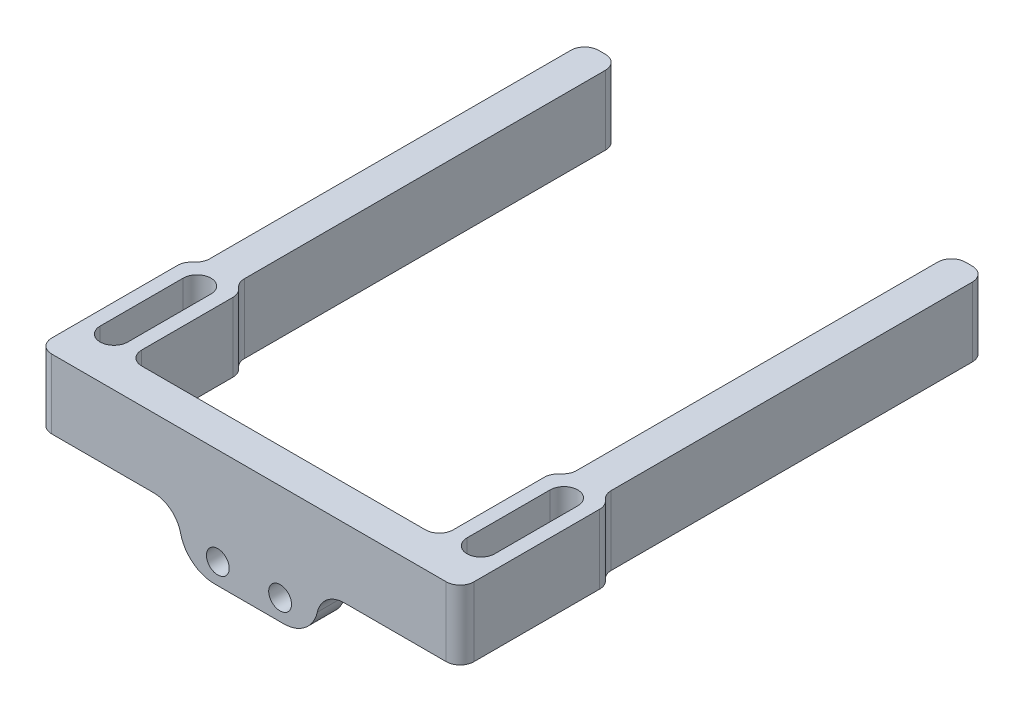
from build123d import *

# Parameters (mm, degrees)
BOSS_EXTRUDE1_DEPTH = 10
FILLET1_R           = 2
FILLET2_R           = 2
BLOCK_START         = 73.5
BLOCK_OUTLINE_R     = 1.65
BLOCK_DEPTH         = 4
BLOCK_START_2       = 77.5
BLOCK_2_DEPTH       = 0.2
CUT_EXTRUDE1_START  = -0.2
CUT_EXTRUDE1_DEPTH  = 0.2
FILLET4_R           = 4


# Read off the part's stored shape, not the designer's step: block
with BuildPart() as part:
    # Sketch1 → Boss-Extrude1 (new body)
    with BuildSketch(Plane(origin=(0, 0, 0), x_dir=(1, 0, 0), z_dir=(0, 1, 0))):
        with BuildLine():
            Line((24, -55), (24, 0))
            Line((24, 0), (29, 0))
            Line((29, 0), (29, -55))
            Line((29, -55), (30.5, -56.5))
            Line((30.5, -56.5), (30.5, -70.5))
            Line((30.5, -70.5), (30.5, -77.5))
            Line((30.5, -77.5), (-30.5, -77.5))
            Line((-30.5, -77.5), (-30.5, -70.5))
            Line((-30.5, -70.5), (-30.5, -56.5))
            Line((-30.5, -56.5), (-29, -55))
            Line((-29, -55), (-29, 0))
            Line((-29, 0), (-24, 0))
            Line((-24, 0), (-24, -55))
            Line((-24, -55), (-22.5, -56.5))
            Line((-22.5, -56.5), (-22.5, -70.5))
            ThreePointArc((-22.5, -70.5), (-21.914213562, -71.914213562), (-20.5, -72.5))
            Line((-20.5, -72.5), (20.5, -72.5))
            ThreePointArc((20.5, -72.5), (21.914213562, -71.914213562), (22.5, -70.5))
            Line((22.5, -70.5), (22.5, -56.5))
            Line((22.5, -56.5), (24, -55))
        make_face()
        with BuildLine():
            Line((24.5, -58.5), (24.5, -70.5))
            ThreePointArc((24.5, -70.5), (26.5, -72.5), (28.5, -70.5))
            Line((28.5, -70.5), (28.5, -58.5))
            ThreePointArc((28.5, -58.5), (26.5, -56.5), (24.5, -58.5))
        make_face(mode=Mode.SUBTRACT)
        with BuildLine():
            Line((-28.5, -70.5), (-28.5, -58.5))
            ThreePointArc((-28.5, -58.5), (-26.5, -56.5), (-24.5, -58.5))
            Line((-24.5, -58.5), (-24.5, -70.5))
            ThreePointArc((-24.5, -70.5), (-26.5, -72.5), (-28.5, -70.5))
        make_face(mode=Mode.SUBTRACT)
    extrude(amount=BOSS_EXTRUDE1_DEPTH)

    # Fillet1
    fillet1_edges = [part.edges().sort_by_distance(p)[0] for p in [
        (30.5, 5, 77.5),
        (-30.5, 5, 77.5),
        (-30.5, 5, 56.5),
        (-29, 5, 55),
        (-24, 5, 55),
        (-22.5, 5, 56.5),
        (22.5, 5, 56.5),
        (24, 5, 55),
        (29, 5, 55),
        (30.5, 5, 56.5),
    ]]
    fillet(fillet1_edges, radius=FILLET1_R)

    # Fillet2
    fillet2_edges = [part.edges().sort_by_distance(p)[0] for p in [
        (-29, 5, 0),
        (-24, 5, 0),
        (24, 5, 0),
        (29, 5, 0),
    ]]
    fillet(fillet2_edges, radius=FILLET2_R)


with BuildPart() as body_2:
    # block outline → block (new body)
    with BuildSketch(Plane.XY.offset(BLOCK_START)):
        with BuildLine():
            Line((-10, 0), (-10, -2))
            ThreePointArc((-10, -2), (-8.535533906, -5.535533906), (-5, -7))
            Line((-5, -7), (5, -7))
            ThreePointArc((5, -7), (8.535533906, -5.535533906), (10, -2))
            Line((10, -2), (10, 0))
            Line((10, 0), (-10, 0))
        make_face()
        with Locations((-4.5, -4)):
            Circle(BLOCK_OUTLINE_R, mode=Mode.SUBTRACT)
        with Locations((4.5, -4)):
            Circle(BLOCK_OUTLINE_R, mode=Mode.SUBTRACT)
    extrude(amount=BLOCK_DEPTH)

    # block 2 outline → block 2 (add)
    with BuildSketch(Plane.XY.offset(BLOCK_START_2)):
        with BuildLine():
            ThreePointArc((-3, -0.5), (-3.2, -0.7), (-3, -0.9))
            Line((-3, -0.9), (3, -0.9))
            ThreePointArc((3, -0.9), (3.2, -0.7), (3, -0.5))
            Line((3, -0.5), (-3, -0.5))
        make_face()
    extrude(amount=BLOCK_2_DEPTH)


with BuildPart() as part_1:
    add(part.part)

    # Combine1: union body 2
    add(body_2.part)

    # Sketch3 → Cut-Extrude1 (cut)
    with BuildSketch(Plane.XY.offset(77.7).offset(CUT_EXTRUDE1_START)):
        with BuildLine():
            Line((-3, -0.9), (3, -0.9))
            ThreePointArc((3, -0.9), (3.2, -0.7), (3, -0.5))
            Line((3, -0.5), (-3, -0.5))
            ThreePointArc((-3, -0.5), (-3.2, -0.7), (-3, -0.9))
        make_face()
    extrude(amount=CUT_EXTRUDE1_DEPTH, mode=Mode.SUBTRACT)

    # Fillet4
    # the kernel refuses this fillet: 4 mm, written as the material it adds along each edge
    with BuildSketch(Plane(origin=(10, 0, 73.5), x_dir=(1, 0, 0), z_dir=(0, 0, 1))) as fillet4_piece_1:
        with BuildLine():
            CenterArc((3.774964387, -4), FILLET4_R, 90, 77.160411594)
            Line((-0.125019785, -3.111111111), (-0.515018202, -3.022222222))
            ThreePointArc((-0.515018202, -3.022222222), (-0.4, -2), (-0.4, 0))
            Line((-0.4, 0), (0, 0.4))
            Line((0, 0.4), (3.774964387, 0.4))
            Line((3.774964387, 0.4), (3.774964387, 0))
        make_face()
    extrude(amount=4)
    with BuildSketch(Plane(origin=(-10, 0, 73.5), x_dir=(-1, 0, 0), z_dir=(0, 0, 1))) as fillet4_piece_2:
        with BuildLine():
            CenterArc((3.774964387, 4), FILLET4_R, 192.839588406, 77.160411594)
            Line((-0.125019785, 3.111111111), (-0.515018202, 3.022222222))
            ThreePointArc((-0.515018202, 3.022222222), (-0.4, 2), (-0.4, 0))
            Line((-0.4, 0), (0, -0.4))
            Line((0, -0.4), (3.774964387, -0.4))
            Line((3.774964387, -0.4), (3.774964387, 0))
        make_face()
    extrude(amount=4)


solid = part_1.part
